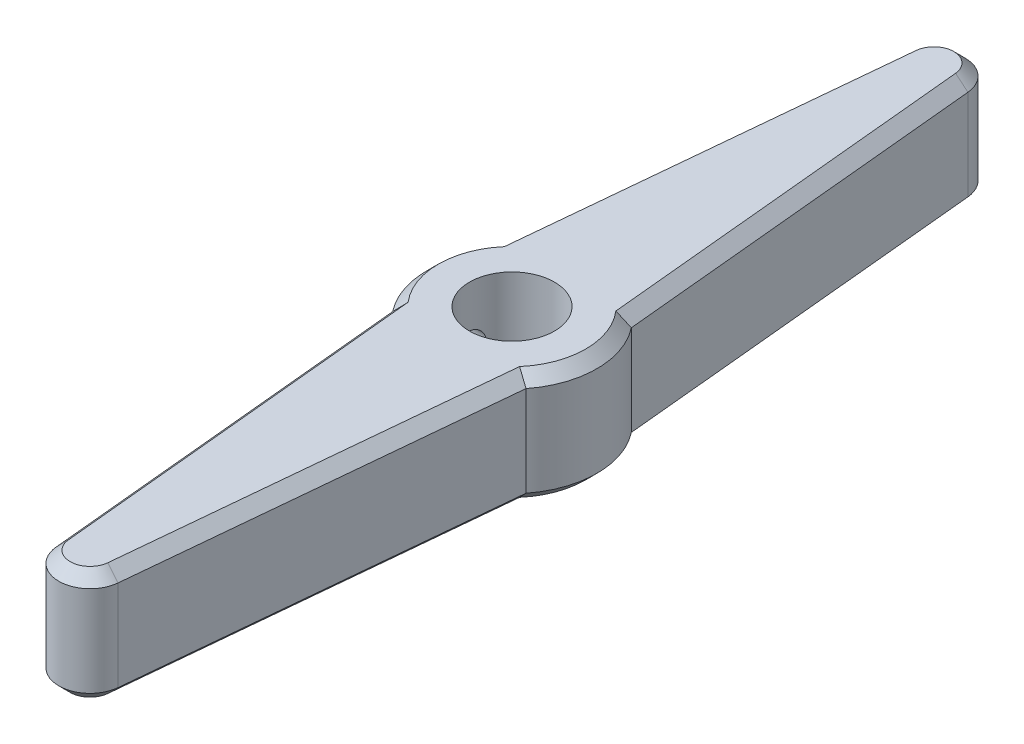
from build123d import *

# Parameters (mm, degrees)
SKETCH1_R               = 9.525
BOSS_EXTRUDE1_DEPTH     = 6.35
BOSS_EXTRUDE2_DEPTH     = 6.35
FILLET1_R               = 3.49359
FILLET1_OF_MIRROR2_R    = 3.49359
CHAMFER1_SIZE           = 1.27
CUT_EXTRUDE1_DEPTH      = 53.073871807
CUT_EXTRUDE1_DEPTH_BACK = 53.073871807
SKETCH1_3_R             = 4.7625
SKETCH3_R               = 1.5875
CUT_EXTRUDE2_DEPTH      = 53.073871807


with BuildPart() as part:
    # Sketch1 → Boss-Extrude1 (new, symmetric)
    with BuildSketch(Plane(origin=(0, 0, 0), x_dir=(1, 0, 0), z_dir=(0, 1, 0))):
        with Locations(Location((0, 0, 0), (0, 0, 270))):
            Circle(SKETCH1_R)
    extrude(amount=BOSS_EXTRUDE1_DEPTH, both=True)

    # Sketch2 → Boss-Extrude2 (add, symmetric)
    with BuildSketch(Plane(origin=(0, 0, 0), x_dir=(1, 0, 0), z_dir=(0, 1, 0))):
        Polygon((-8.040009509, 0), (8.040009509, 0), (3.175, 50.8), (-3.175, 50.8), align=None)
    boss_extrude2 = extrude(amount=BOSS_EXTRUDE2_DEPTH, both=True)

    # Fillet1
    fillet1_edges = [part.edges().sort_by_distance(p)[0] for p in [
        (-3.175, 0, -50.8),
        (3.175, 0, -50.8),
    ]]
    fillet(fillet1_edges, radius=FILLET1_R - 0.0001)  # a hair under: the kernel refuses the full size

    # Mirror2: Boss-Extrude2 across plane
    add(boss_extrude2.mirror(Plane.XY))

    # Fillet1 of Mirror2
    fillet1_of_mirror2_edges = [part.edges().sort_by_distance(p)[0] for p in [
        (-3.175, 0, 50.8),
        (3.175, 0, 50.8),
    ]]
    fillet(fillet1_of_mirror2_edges, radius=FILLET1_OF_MIRROR2_R - 0.0001)  # a hair under: the kernel refuses the full size

    # Chamfer1
    chamfer1_edges = [part.edges().sort_by_distance(p)[0] for p in [
        (5.476138131, -6.35, -26.771718685),
        (5.476138131, 6.35, -26.771718685),
        (-5.476138131, -6.35, -26.771718685),
        (-5.476138131, 6.35, -26.771718685),
        (0, -6.35, -50.8),
        (0, 6.35, -50.8),
        (9.525, -6.35, 0),
        (9.525, 6.35, 0),
        (5.476138131, 6.35, 26.771718685),
        (5.476138131, -6.35, 26.771718685),
        (-9.525, -6.35, 0),
        (-5.476138131, -6.35, 26.771718685),
        (-5.476138131, 6.35, 26.771718685),
        (0, 6.35, 50.8),
        (0, -6.35, 50.8),
        (-9.525, 6.35, 0),
    ]]
    chamfer(chamfer1_edges, length=CHAMFER1_SIZE)

    # Sketch1<3> → Cut-Extrude1 (cut, two sides: drawn at the far end of the back side and taken through both)
    with BuildSketch(Plane(origin=(0, 0, 0), x_dir=(1, 0, 0), z_dir=(0, 1, 0)).offset(-CUT_EXTRUDE1_DEPTH_BACK)):
        with Locations(Location((0, 0, 0), (0, 0, 270))):
            Circle(SKETCH1_3_R)
    extrude(amount=CUT_EXTRUDE1_DEPTH + CUT_EXTRUDE1_DEPTH_BACK, mode=Mode.SUBTRACT)

    # Sketch3 → Cut-Extrude2 (cut, through all)
    with BuildSketch(Plane(origin=(0, 0, 0), x_dir=(0, 0, -1), z_dir=(1, 0, 0))):
        Circle(SKETCH3_R)
    extrude(amount=-CUT_EXTRUDE2_DEPTH, mode=Mode.SUBTRACT)


solid = part.part
